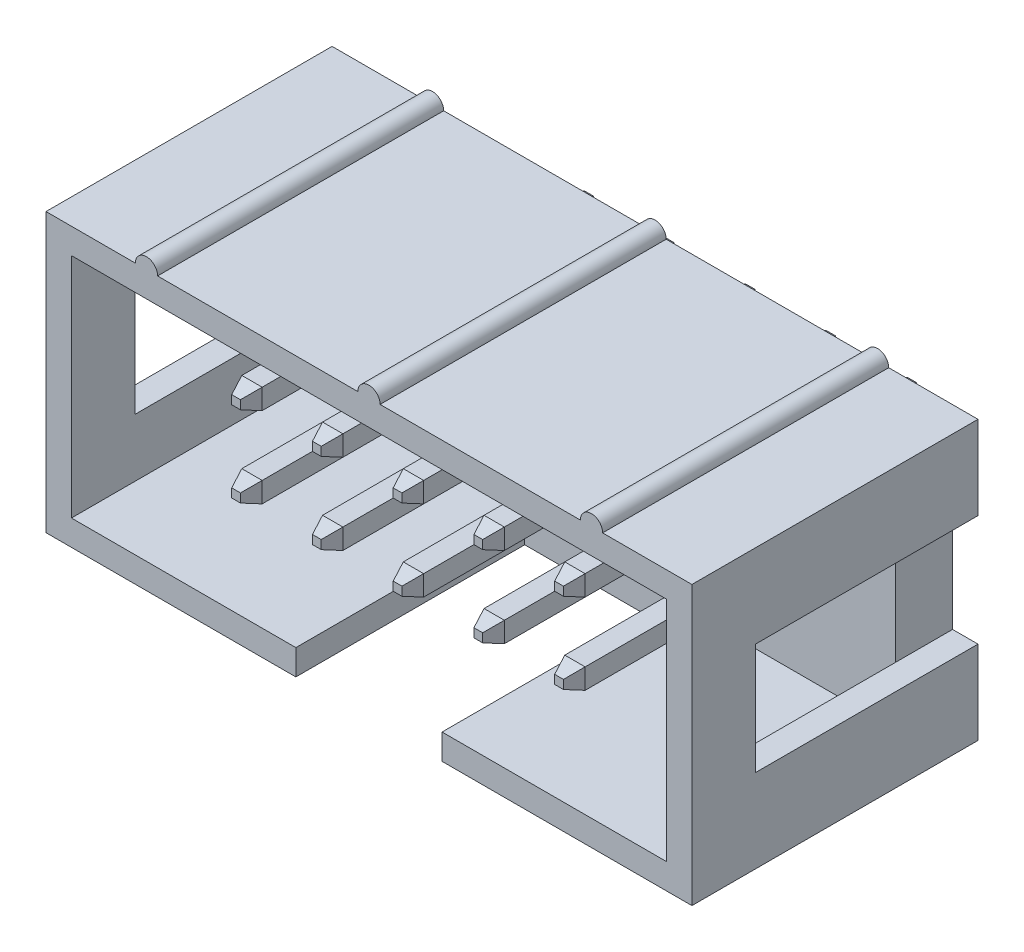
from build123d import *
from OCP.BRepFilletAPI import BRepFilletAPI_MakeChamfer

# Parameters (mm, degrees)
SKETCH_1_W               = 20.32
SKETCH_1_H               = 8.75
EXTRUDE_1_DEPTH          = 1.8
SKETCH_2_W               = 20.32
SKETCH_2_H               = 8.75
SKETCH_2_W_2             = 18.72
SKETCH_2_H_2             = 7.15
EXTRUDE_2_DEPTH          = 7.2
CUT_EXTRUDE_START        = -1.8
SKETCH_3_W               = 0.8
SKETCH_3_H               = 3.5
CUT_EXTRUDE_1_DEPTH      = 7
SKETCH_4_W               = 4.6
SKETCH_4_H               = 0.8
CUT_EXTRUDE_2_DEPTH      = 7.2
EXTRUDE_3_DEPTH          = 6.3
EXTRUDE_3_DEPTH_BACK     = 4.8
SKETCH_5_W               = 0.64
SKETCH_5_H               = 0.64
CHAMFER_2_SIZE           = 0.5
CHAMFER_2_SIZE2          = 0.181985117
CHAMFER_8_SIZE           = 0.5
CHAMFER_8_SIZE2          = 0.181985117
CUT_EXTRUDE_3_DEPTH      = 0.1
PATTERN_LINEAR_1_COUNT   = 3
PATTERN_LINEAR_1_PITCH   = 2.54
PATTERN_LINEAR_1_2_COUNT = 2
PATTERN_LINEAR_1_2_PITCH = 2.54
SKETCH_7_R               = 0.35
EXTRUDE_4_DEPTH          = 9


with BuildPart() as part:
    # Эскиз1 → Бобышка-Вытянуть1 (new body)
    with BuildSketch(Plane.XY):
        Rectangle(SKETCH_1_W, SKETCH_1_H)
    extrude(amount=EXTRUDE_1_DEPTH)

    # Эскиз2 → Бобышка-Вытянуть2 (add)
    with BuildSketch(Plane.XY.offset(1.8)):
        Rectangle(SKETCH_2_W, SKETCH_2_H)
        Rectangle(SKETCH_2_W_2, SKETCH_2_H_2, mode=Mode.SUBTRACT)
    extrude(amount=EXTRUDE_2_DEPTH)

    # Эскиз3 → Вырез-Вытянуть1 (cut)
    with BuildSketch(Plane.XY.offset(1.8).offset(CUT_EXTRUDE_START)):
        with Locations((9.76, 0)):
            Rectangle(SKETCH_3_W, SKETCH_3_H)
        with Locations((-9.76, 0)):
            Rectangle(SKETCH_3_W, SKETCH_3_H)
    extrude(amount=CUT_EXTRUDE_1_DEPTH, mode=Mode.SUBTRACT)

    # Эскиз4 → Вырез-Вытянуть2 (cut)
    with BuildSketch(Plane.XY.offset(9)):
        with Locations((0, -3.975)):
            Rectangle(SKETCH_4_W, SKETCH_4_H)
    extrude(amount=-CUT_EXTRUDE_2_DEPTH, mode=Mode.SUBTRACT)

    # Эскиз6 → Вырез-Вытянуть3 (cut)
    with BuildSketch(Plane.XZ.offset(4.375)):
        Polygon((-4.976440372, 5.189720174), (-3.184624847, 5.189720174), (-4.08053261, 3.716247509), align=None)
    extrude(amount=-CUT_EXTRUDE_3_DEPTH, mode=Mode.SUBTRACT)

    # Эскиз7 → Бобышка-Вытянуть4 (add)
    with BuildSketch(Plane.XY.offset(9)):
        with Locations((0, 4.375)):
            Circle(SKETCH_7_R)
        with Locations((7, 4.375)):
            Circle(SKETCH_7_R)
        with Locations((-7, 4.375)):
            Circle(SKETCH_7_R)
    extrude(amount=-EXTRUDE_4_DEPTH)


with BuildPart() as body_2:
    # Эскиз5 → Бобышка-Вытянуть3 (new, two sides: drawn at the far end of the back side and taken through both)
    with BuildSketch(Plane.XY.offset(1.8).offset(-EXTRUDE_3_DEPTH_BACK)):
        with Locations((0, 1.27)):
            Rectangle(SKETCH_5_W, SKETCH_5_H)
    extrude(amount=EXTRUDE_3_DEPTH + EXTRUDE_3_DEPTH_BACK)

    # Фаска2: one chamfer whose edges measure the first distance from different faces: ONE call of the kernel's chamfer builder (chamfer() names one face for all edges)
    chamfer_2_edges_1 = [body_2.edges().sort_by_distance(p)[0] for p in [
        (-0.32, 1.27, -3),
    ]]
    chamfer_2_side_1 = [body_2.faces().sort_by_distance(p)[0] for p in [
        (-0.32, 1.27, 2.55),
    ]]
    chamfer_2_edges_2 = [body_2.edges().sort_by_distance(p)[0] for p in [
        (0, 1.59, -3),
    ]]
    chamfer_2_side_2 = [body_2.faces().sort_by_distance(p)[0] for p in [
        (0, 1.59, 2.55),
    ]]
    chamfer_2_edges_3 = [body_2.edges().sort_by_distance(p)[0] for p in [
        (0.32, 1.27, -3),
    ]]
    chamfer_2_side_3 = [body_2.faces().sort_by_distance(p)[0] for p in [
        (0.32, 1.27, 2.55),
    ]]
    chamfer_2_edges_4 = [body_2.edges().sort_by_distance(p)[0] for p in [
        (0, 0.95, -3),
    ]]
    chamfer_2_side_4 = [body_2.faces().sort_by_distance(p)[0] for p in [
        (0, 0.95, 2.55),
    ]]
    chamfer_2 = BRepFilletAPI_MakeChamfer(body_2.part.solid().wrapped)
    for e in chamfer_2_edges_1:
        chamfer_2.Add(CHAMFER_2_SIZE, CHAMFER_2_SIZE2, e.wrapped, chamfer_2_side_1[0].wrapped)  # the first distance lies on this face
    for e in chamfer_2_edges_2:
        chamfer_2.Add(CHAMFER_2_SIZE, CHAMFER_2_SIZE2, e.wrapped, chamfer_2_side_2[0].wrapped)  # the first distance lies on this face
    for e in chamfer_2_edges_3:
        chamfer_2.Add(CHAMFER_2_SIZE, CHAMFER_2_SIZE2, e.wrapped, chamfer_2_side_3[0].wrapped)  # the first distance lies on this face
    for e in chamfer_2_edges_4:
        chamfer_2.Add(CHAMFER_2_SIZE, CHAMFER_2_SIZE2, e.wrapped, chamfer_2_side_4[0].wrapped)  # the first distance lies on this face
    add(Compound.cast(chamfer_2.Shape()), mode=Mode.REPLACE)

    # Фаска8: one chamfer whose edges measure the first distance from different faces: ONE call of the kernel's chamfer builder (chamfer() names one face for all edges)
    chamfer_8_edges_1 = [body_2.edges().sort_by_distance(p)[0] for p in [
        (0, 1.59, 8.1),
    ]]
    chamfer_8_side_1 = [body_2.faces().sort_by_distance(p)[0] for p in [
        (0, 1.59, 2.8),
    ]]
    chamfer_8_edges_2 = [body_2.edges().sort_by_distance(p)[0] for p in [
        (0.32, 1.27, 8.1),
    ]]
    chamfer_8_side_2 = [body_2.faces().sort_by_distance(p)[0] for p in [
        (0.32, 1.27, 2.8),
    ]]
    chamfer_8_edges_3 = [body_2.edges().sort_by_distance(p)[0] for p in [
        (0, 0.95, 8.1),
    ]]
    chamfer_8_side_3 = [body_2.faces().sort_by_distance(p)[0] for p in [
        (0, 0.95, 2.8),
    ]]
    chamfer_8_edges_4 = [body_2.edges().sort_by_distance(p)[0] for p in [
        (-0.32, 1.27, 8.1),
    ]]
    chamfer_8_side_4 = [body_2.faces().sort_by_distance(p)[0] for p in [
        (-0.32, 1.27, 2.8),
    ]]
    chamfer_8 = BRepFilletAPI_MakeChamfer(body_2.part.solid().wrapped)
    for e in chamfer_8_edges_1:
        chamfer_8.Add(CHAMFER_8_SIZE, CHAMFER_8_SIZE2, e.wrapped, chamfer_8_side_1[0].wrapped)  # the first distance lies on this face
    for e in chamfer_8_edges_2:
        chamfer_8.Add(CHAMFER_8_SIZE, CHAMFER_8_SIZE2, e.wrapped, chamfer_8_side_2[0].wrapped)  # the first distance lies on this face
    for e in chamfer_8_edges_3:
        chamfer_8.Add(CHAMFER_8_SIZE, CHAMFER_8_SIZE2, e.wrapped, chamfer_8_side_3[0].wrapped)  # the first distance lies on this face
    for e in chamfer_8_edges_4:
        chamfer_8.Add(CHAMFER_8_SIZE, CHAMFER_8_SIZE2, e.wrapped, chamfer_8_side_4[0].wrapped)  # the first distance lies on this face
    add(Compound.cast(chamfer_8.Shape()), mode=Mode.REPLACE)


with BuildPart() as pattern_linear_1_1:
    # Линейный массив1: pattern copy
    add(body_2.part.moved(Location(Vector(-1, 0, 0) * (1 * PATTERN_LINEAR_1_PITCH))))


with BuildPart() as pattern_linear_1_2:
    # Линейный массив1: pattern copy
    add(body_2.part.moved(Location(Vector(-1, 0, 0) * (2 * PATTERN_LINEAR_1_PITCH))))


with BuildPart() as pattern_linear_1_2_1:
    # Pattern Linear 1 2: pattern copy
    add(body_2.part.moved(Location(Vector(0, -1, 0) * (1 * PATTERN_LINEAR_1_2_PITCH))))


with BuildPart() as pattern_linear_1_2_2:
    # Pattern Linear 1 2: pattern copy
    add(pattern_linear_1_1.part.moved(Location(Vector(0, -1, 0) * (1 * PATTERN_LINEAR_1_2_PITCH))))


with BuildPart() as pattern_linear_1_2_3:
    # Pattern Linear 1 2: pattern copy
    add(pattern_linear_1_2.part.moved(Location(Vector(0, -1, 0) * (1 * PATTERN_LINEAR_1_2_PITCH))))


with BuildPart() as body_8:
    # Линейный массив2: read off the stored shape, not the designer's step
    # Линейный массив2: copy of Линейный массив1 2_3
    add(pattern_linear_1_2_3.part.moved(Location((10.16, 0, 0))))


with BuildPart() as body_9:
    # Pattern Linear 2 2: copy of Линейный массив1 2_3
    add(pattern_linear_1_2_3.part.moved(Location((7.62, 0, 0))))


with BuildPart() as body_10:
    # Pattern Linear 2 3: copy of Линейный массив1 2_3
    add(pattern_linear_1_2_3.part.moved(Location((10.16, 2.54, 0))))


with BuildPart() as body_11:
    # Pattern Linear 2 4: copy of Линейный массив1 2_3
    add(pattern_linear_1_2_3.part.moved(Location((7.62, 2.54, 0))))


solid = Compound([part.part, body_2.part, pattern_linear_1_1.part, pattern_linear_1_2.part, pattern_linear_1_2_1.part, pattern_linear_1_2_2.part, pattern_linear_1_2_3.part, body_8.part, body_9.part, body_10.part, body_11.part])
